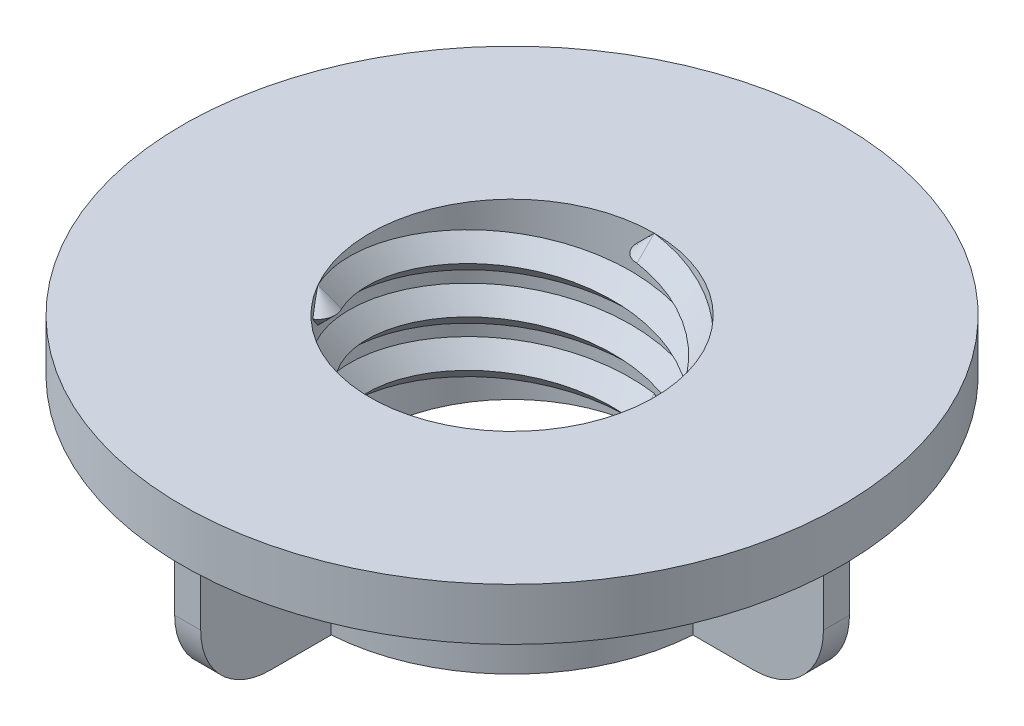
from build123d import *

# Parameters (mm, degrees)
BOSS_EXTRUDE1_DEPTH = 1.5
CIRPATTERN1_COUNT   = 4
SWEEP1_PITCH        = 16
REVOLVE2_ANGLE      = 90
REVOLVE3_ANGLE      = 90
CIRPATTERN2_COUNT   = 3


with BuildPart() as part:
    # Sketch2 → Revolve1 (revolve)
    with BuildSketch(Plane.XY, mode=Mode.PRIVATE) as revolve1_sk:
        Polygon((16.4, 0), (16.4, 20), (38, 20), (38, 14), (22.4, 14), (22.4, 0), align=None)
    revolve(revolve1_sk.sketch.rotate(Axis((0, 0, 0), (0, 1, 0)), 90), axis=Axis((0, 0, 0), (0, 1, 0)))

    # Sketch3 → Boss-Extrude1 (add, symmetric)
    with BuildSketch(Plane.XY):
        with BuildLine():
            Line((-37.4, 14), (-37.4, 8))
            ThreePointArc((-37.4, 8), (-35.056854249, 2.343145751), (-29.4, 0))
            Line((-29.4, 0), (-20.4, 0))
            Line((-20.4, 0), (-20.4, 14))
            Line((-20.4, 14), (-22.4, 14))
            Line((-22.4, 14), (-37.4, 14))
        make_face()
    boss_extrude1 = extrude(amount=BOSS_EXTRUDE1_DEPTH, both=True)

    # CirPattern1: Boss-Extrude1 ×4 about axis
    cirpattern1_axis = Axis((0, 0, 0), (0, 1, 0))
    for i in range(1, CIRPATTERN1_COUNT):
        add(boss_extrude1.rotate(cirpattern1_axis, i * 360 / CIRPATTERN1_COUNT))

    # Sweep1: the profile of Sketch5 profile screwed along a right-hand helix of 1 turns, 18 arcs to a turn; built about Z, then put on its axis
    sweep1_z = Axis((0, 0, 0), (0, 0, 1))
    sweep1_corners = [(16.4003, 0, -0.0003), (16.4003, 0, 4.0003), (14.4, 0, 2)]
    with BuildLine(mode=Mode.PRIVATE) as sweep1_profile:
        Line(sweep1_corners[0], sweep1_corners[1])
        Line(sweep1_corners[1], sweep1_corners[2])
        Line(sweep1_corners[2], sweep1_corners[0])
    sweep1_cap = Face(sweep1_profile.wire())
    sweep1_turn_angles = [0, 10, 20, 30, 40, 50, 60, 70, 80, 90, 100, 110, 120, 130, 140, 150, 160, 170, 180, 190, 200, 210, 220, 230, 240, 250, 260, 270, 280, 290, 300, 310, 320, 330, 340, 350, 360]
    sweep1_turn_weights = [1, 0.984807753012208, 1, 0.984807753012208, 1, 0.984807753012208, 1, 0.984807753012208, 1, 0.984807753012208, 1, 0.984807753012208, 1, 0.984807753012208, 1, 0.984807753012208, 1, 0.984807753012208, 1, 0.984807753012208, 1, 0.984807753012208, 1, 0.984807753012208, 1, 0.984807753012208, 1, 0.984807753012208, 1, 0.984807753012208, 1, 0.984807753012208, 1, 0.984807753012208, 1, 0.984807753012208, 1]
    sweep1_turn_rails = [Edge.make_bspline([Vector(p[0], p[1], 0).rotate(sweep1_z, sweep1_turn_angles[k]) / sweep1_turn_weights[k] + Vector(0, 0, p[2] + SWEEP1_PITCH * sweep1_turn_angles[k] / 360) for k in range(37)], [0, 0, 0, 1, 1, 2, 2, 3, 3, 4, 4, 5, 5, 6, 6, 7, 7, 8, 8, 9, 9, 10, 10, 11, 11, 12, 12, 13, 13, 14, 14, 15, 15, 16, 16, 17, 17, 18, 18, 18], 2, sweep1_turn_weights) for p in sweep1_corners]
    sweep1_turn_sides = [Face.make_surface_from_curves(sweep1_turn_rails[p[0]], sweep1_turn_rails[p[1]]) for p in [(0, 1), (1, 2), (2, 0)]]
    sweep1 = Plane(origin=(0, 0, 0), x_dir=(0, 0, -1), z_dir=(0, 1, 0)) * Solid(Shell([*sweep1_turn_sides, sweep1_cap, sweep1_cap.rotate(sweep1_z, 360).moved(Location((0, 0, SWEEP1_PITCH * 360 / 360)))]))
    add(sweep1)

    # Sketch6 → Revolve2 (revolve)
    with BuildSketch(Plane(origin=(0, 0, 0), x_dir=(0, 0, -1), z_dir=(1, 0, 0))):
        Polygon((16.4, 0), (16.4, 4), (14.4, 2), align=None)
    revolve2 = revolve(axis=Axis((0, 0, -16.4), (0, 1, 0)), revolution_arc=REVOLVE2_ANGLE)

    # Sketch7 → Revolve3 (revolve)
    with BuildSketch(Plane.ZY):
        Polygon((-16.4, 20), (-16.4, 16), (-14.4, 18), align=None)
    revolve3 = revolve(axis=Axis((0, 20, -16.4), (0, -1, 0)), revolution_arc=REVOLVE3_ANGLE)

    # CirPattern2: Sweep1, Revolve2, Revolve3 ×3 about axis
    cirpattern2_axis = Axis((0, 0, 0), (0, -1, 0))
    add([sweep1.rotate(cirpattern2_axis, i * 360 / CIRPATTERN2_COUNT) for i in range(1, CIRPATTERN2_COUNT)])
    add([revolve2.rotate(cirpattern2_axis, i * 360 / CIRPATTERN2_COUNT) for i in range(1, CIRPATTERN2_COUNT)])
    add([revolve3.rotate(cirpattern2_axis, i * 360 / CIRPATTERN2_COUNT) for i in range(1, CIRPATTERN2_COUNT)])


solid = part.part
